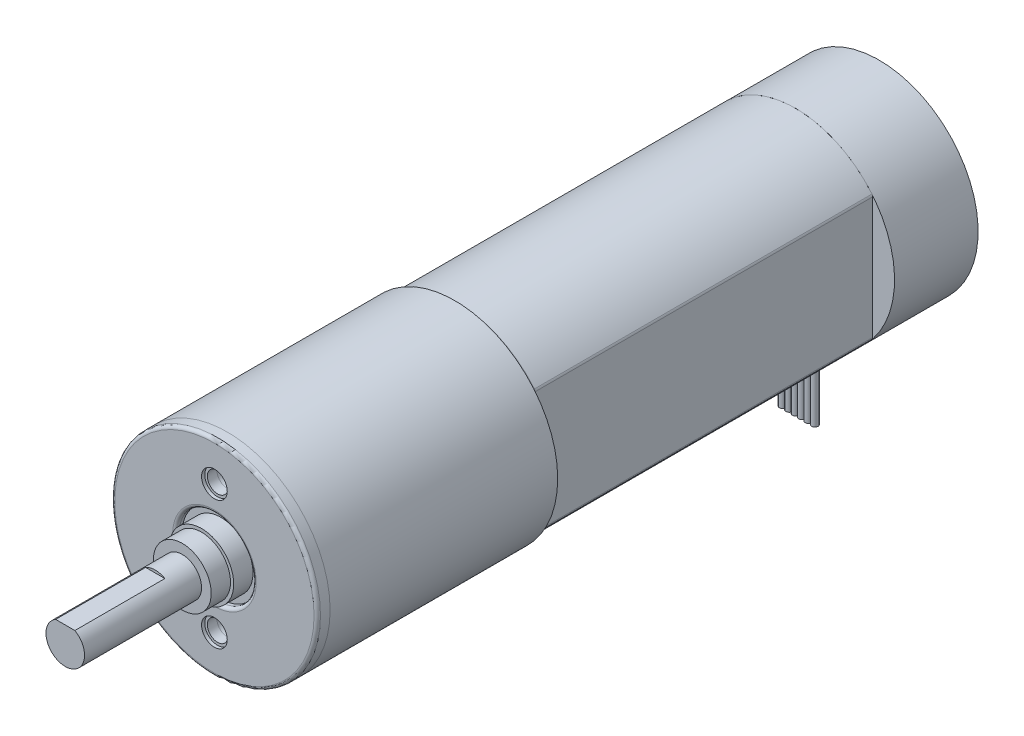
from build123d import *

# Parameters (mm, degrees)
SKETCH_1_R                       = 7.7
EXTRUDE_1_DEPTH                  = 26.5
CUT_EXTRUDE_1_DEPTH              = 29.65013089
FILLET_1_R                       = 0.25
SKETCH_4_R                       = 8
EXTRUDE_2_DEPTH                  = 17.7
SKETCH_5_R                       = 8
EXTRUDE_3_DEPTH                  = 1
SKETCH_6_R                       = 3
CUT_EXTRUDE_2_DEPTH              = 0.5
FILLET_3_R                       = 0.25
SKETCH_7_R                       = 2.5
EXTRUDE_4_DEPTH                  = 1.5
SKETCH_8_R                       = 2.25
EXTRUDE_5_DEPTH                  = 1.5
SKETCH_9_R                       = 1.5
EXTRUDE_6_DEPTH                  = 9.1
CUT_EXTRUDE_3_DEPTH              = 7
M2X0_4_1_AT_2_COUNT              = 2
M2X0_4_1_AT_2_PITCH              = 10
SKETCH_16_R                      = 1
CUT_EXTRUDE_4_DEPTH              = 0.25
CUT_EXTRUDE_5_DEPTH              = 0.75
SKETCH_18_R                      = 2.5
EXTRUDE_7_DEPTH                  = 2.5
FILLET_4_R                       = 0.25
SKETCH_19_R                      = 0.5
EXTRUDE_8_DEPTH                  = 0.5
SKETCH_20_W                      = 0.6
SKETCH_20_H                      = 0.2
EXTRUDE_9_DEPTH                  = 3
SKETCH_21_R                      = 0.15
CUT_EXTRUDE_6_DEPTH              = 60.02075906
FILLET_5_R                       = 0.3
PATTERN_CIRCULAR_1_COUNT         = 2
FILLET_5_OF_PATTERN_CIRCULAR_1_R = 0.3
SKETCH_23_R                      = 7.7
EXTRUDE_10_DEPTH                 = 6.5
CUT_EXTRUDE_7_DEPTH              = 60.068180968
CUT_EXTRUDE_7_DEPTH_BACK         = 3
SKETCH_25_W                      = 3
SKETCH_25_H                      = 0.5
SKETCH_26_R                      = 0.25
EXTRUDE_13_DEPTH                 = 10
PATTERN_LINEAR_1_COUNT           = 6
PATTERN_LINEAR_1_PITCH           = 0.5


with BuildPart() as part:
    # 草圖1 → 填料-伸長1 (new body)
    with BuildSketch(Plane.XY):
        Circle(SKETCH_1_R)
    extrude(amount=EXTRUDE_1_DEPTH)

    # 草圖2 → 除料-伸長1 (cut, through all)
    with BuildSketch(Plane.XY.offset(26.5)):
        with BuildLine():
            Line((-6, -4.825971405), (-6, 4.825971405))
            ThreePointArc((-6, 4.825971405), (-7.7, 0), (-6, -4.825971405))
        make_face()
        with BuildLine():
            ThreePointArc((7.7, 0), (7.262575301, 2.558319761), (6, 4.825971405))
            Line((6, 4.825971405), (6, -4.825971405))
            ThreePointArc((6, -4.825971405), (7.262575301, -2.558319761), (7.7, 0))
        make_face()
    extrude(amount=-CUT_EXTRUDE_1_DEPTH, mode=Mode.SUBTRACT)

    # 圓角1
    fillet_1_edges = [part.edges().sort_by_distance(p)[0] for p in [
        (-6, 0, 26.5),
        (-6, 4.825971405, 13.25),
        (-6, -4.825971405, 13.25),
        (6, 4.825971405, 13.25),
        (6, -4.825971405, 13.25),
        (6, 0, 26.5),
        (0, 7.7, 26.5),
        (0, -7.7, 26.5),
    ]]
    fillet(fillet_1_edges, radius=FILLET_1_R)

    # 草圖4 → 填料-伸長2 (add)
    with BuildSketch(Plane.XY.offset(26.5)):
        Circle(SKETCH_4_R)
    extrude(amount=EXTRUDE_2_DEPTH)


with BuildPart() as body_2:
    # 草圖5 → 填料-伸長3 (new body)
    with BuildSketch(Plane.XY.offset(44.2)):
        Circle(SKETCH_5_R)
    extrude(amount=EXTRUDE_3_DEPTH)

    # 草圖6 → 除料-伸長2 (cut)
    with BuildSketch(Plane.XY.offset(45.2)):
        Circle(SKETCH_6_R)
    extrude(amount=-CUT_EXTRUDE_2_DEPTH, mode=Mode.SUBTRACT)

    # 圓角3
    fillet_3_edges = [body_2.edges().sort_by_distance(p)[0] for p in [
        (-8, 0, 45.2),
        (-3, 0, 45.2),
    ]]
    fillet(fillet_3_edges, radius=FILLET_3_R)

    # 草圖7 → 填料-伸長4 (add)
    with BuildSketch(Plane.XY.offset(44.7)):
        Circle(SKETCH_7_R)
    extrude(amount=EXTRUDE_4_DEPTH)


with BuildPart() as body_3:
    # 草圖8 → 填料-伸長5 (new body)
    with BuildSketch(Plane.XY.offset(46.2)):
        Circle(SKETCH_8_R)
    extrude(amount=EXTRUDE_5_DEPTH)

    # 草圖9 → 填料-伸長6 (add)
    with BuildSketch(Plane.XY.offset(47.7)):
        Circle(SKETCH_9_R)
    extrude(amount=EXTRUDE_6_DEPTH)

    # 草圖10 → 除料-伸長3 (cut)
    with BuildSketch(Plane.XY.offset(56.8)):
        with BuildLine():
            Line((-0.748331477, 1.3), (0.748331477, 1.3))
            ThreePointArc((0.748331477, 1.3), (0, 1.5), (-0.748331477, 1.3))
        make_face()
    extrude(amount=-CUT_EXTRUDE_3_DEPTH, mode=Mode.SUBTRACT)


with BuildPart() as m2x0_4_1_tool:
    # 草圖15 → M2x0.4 螺紋孔1 (revolve)
    with BuildSketch(Plane(origin=(0, -5, 45.2), x_dir=(0, -1, 0), z_dir=(1, 0, 0))):
        Polygon((0, 0), (0, 3.480688495), (0.8, 3), (0.8, 0), align=None)
    m2x0_4_1 = revolve(axis=Axis((0, -5, 51.55), (0, 0, -1)))


with BuildPart() as part_1:
    add(part.part)

    # M2x0.4 螺紋孔1: cut by m2x0_4_1_tool
    add(m2x0_4_1_tool.part, mode=Mode.SUBTRACT)


with BuildPart() as body_2_1:
    add(body_2.part)

    # M2x0.4 螺紋孔1: cut by m2x0_4_1_tool
    add(m2x0_4_1_tool.part, mode=Mode.SUBTRACT)


with BuildPart() as m2x0_4_1_at_2_tool:
    # M2x0.4 螺紋孔1 at 2: M2x0.4 螺紋孔1 ×2
    with Locations(*[(0, i * M2X0_4_1_AT_2_PITCH, 0) for i in range(1, M2X0_4_1_AT_2_COUNT)]):
        add(m2x0_4_1)


with BuildPart() as part_2:
    add(part_1.part)

    # M2x0.4 螺紋孔1 at 2: cut by m2x0_4_1_at_2_tool
    add(m2x0_4_1_at_2_tool.part, mode=Mode.SUBTRACT)

    # 草圖17 → 除料-伸長5 (cut)
    with BuildSketch(Plane(origin=(0, 0, 0), x_dir=(-1, 0, 0), z_dir=(0, 0, -1))):
        with BuildLine():
            Line((-5.75, 4.631978395), (-5.75, -4.631978395))
            ThreePointArc((-5.75, -4.631978395), (0, -7.383611844), (5.75, -4.631978395))
            Line((5.75, -4.631978395), (5.75, 4.631978395))
            ThreePointArc((5.75, 4.631978395), (0, 7.383611844), (-5.75, 4.631978395))
        make_face()
    extrude(amount=-CUT_EXTRUDE_5_DEPTH, mode=Mode.SUBTRACT)

    # 草圖18 → 填料-伸長7 (add)
    with BuildSketch(Plane(origin=(0, 0, 0.75), x_dir=(-1, 0, 0), z_dir=(0, 0, -1))):
        with Locations(Location((0, 0, 0), (0, 0, 180))):
            Circle(SKETCH_18_R)
    extrude(amount=EXTRUDE_7_DEPTH)

    # 圓角4
    fillet_4_edges = [part_2.edges().sort_by_distance(p)[0] for p in [
        (-2.5, 0, -1.75),
    ]]
    fillet(fillet_4_edges, radius=FILLET_4_R)

    # 草圖19 → 填料-伸長8 (add)
    with BuildSketch(Plane(origin=(0, 0, 0.75), x_dir=(-1, 0, 0), z_dir=(0, 0, -1))):
        with Locations((0, 6)):
            Circle(SKETCH_19_R)
    extrude_8 = extrude(amount=EXTRUDE_8_DEPTH)

    # 草圖20 → 填料-伸長9 (add)
    with BuildSketch(Plane(origin=(0, 0, 0.25), x_dir=(-1, 0, 0), z_dir=(0, 0, -1))):
        with Locations((0, 6)):
            Rectangle(SKETCH_20_W, SKETCH_20_H)
    extrude_9 = extrude(amount=EXTRUDE_9_DEPTH)

    # 草圖21 → 除料-伸長6 (cut, through all)
    with BuildSketch(Plane.XZ.offset(-5.9)):
        with Locations(Location((0, -2.25, 0), (0, 0, 270))):
            Circle(SKETCH_21_R)
    cut_extrude_6 = extrude(amount=-CUT_EXTRUDE_6_DEPTH, mode=Mode.SUBTRACT)

    # 圓角5
    fillet_5_edges = [part_2.edges().sort_by_distance(p)[0] for p in [
        (-0.3, 6, -2.75),
        (0.3, 6, -2.75),
    ]]
    fillet(fillet_5_edges, radius=FILLET_5_R - 0.0001)  # a hair under: the kernel refuses the full size

    # 環狀複製排列1: 填料-伸長8, 填料-伸長9, 除料-伸長6 ×2 about axis
    pattern_circular_1_axis = Axis((0, 0, 0), (0, 0, 1))
    add([extrude_8.rotate(pattern_circular_1_axis, i * 360 / PATTERN_CIRCULAR_1_COUNT) for i in range(1, PATTERN_CIRCULAR_1_COUNT)])
    add([extrude_9.rotate(pattern_circular_1_axis, i * 360 / PATTERN_CIRCULAR_1_COUNT) for i in range(1, PATTERN_CIRCULAR_1_COUNT)])
    add([cut_extrude_6.rotate(pattern_circular_1_axis, i * 360 / PATTERN_CIRCULAR_1_COUNT) for i in range(1, PATTERN_CIRCULAR_1_COUNT)], mode=Mode.SUBTRACT)

    # 圓角5 of 環狀複製排列1
    fillet_5_of_pattern_circular_1_edges = [part_2.edges().sort_by_distance(p)[0] for p in [
        (0.3, -6, -2.75),
        (-0.3, -6, -2.75),
    ]]
    fillet(fillet_5_of_pattern_circular_1_edges, radius=FILLET_5_OF_PATTERN_CIRCULAR_1_R - 0.0001)  # a hair under: the kernel refuses the full size


with BuildPart() as body_2_2:
    add(body_2_1.part)

    # M2x0.4 螺紋孔1 at 2: cut by m2x0_4_1_at_2_tool
    add(m2x0_4_1_at_2_tool.part, mode=Mode.SUBTRACT)

    # 草圖16 → 除料-伸長4 (cut)
    with BuildSketch(Plane.XY.offset(45.2)):
        with Locations((0, -5)):
            Circle(SKETCH_16_R)
        with Locations((0, 5)):
            Circle(SKETCH_16_R)
    extrude(amount=-CUT_EXTRUDE_4_DEPTH, mode=Mode.SUBTRACT)


with BuildPart() as body_4:
    # 草圖23 → 填料-伸長10 (new body)
    with BuildSketch(Plane(origin=(0, 0, 0), x_dir=(-1, 0, 0), z_dir=(0, 0, -1))):
        with Locations(Location((0, 0, 0), (0, 0, 180))):
            Circle(SKETCH_23_R)
    extrude(amount=EXTRUDE_10_DEPTH)


with BuildPart() as cut_extrude_7_tool:
    # 草圖25 → 除料-伸長7 (new, two sides: drawn at the far end of the back side and taken through both)
    with BuildSketch(Plane.XZ.offset(6.1).offset(-CUT_EXTRUDE_7_DEPTH_BACK)):
        with Locations((0, -0.25)):
            Rectangle(SKETCH_25_W, SKETCH_25_H)
    extrude(amount=CUT_EXTRUDE_7_DEPTH + CUT_EXTRUDE_7_DEPTH_BACK)


with BuildPart() as part_3:
    add(part_2.part)

    # 除料-伸長7: cut by cut_extrude_7_tool
    add(cut_extrude_7_tool.part, mode=Mode.SUBTRACT)


with BuildPart() as body_4_1:
    add(body_4.part)

    # 除料-伸長7: cut by cut_extrude_7_tool
    add(cut_extrude_7_tool.part, mode=Mode.SUBTRACT)


with BuildPart() as body_5:
    # 草圖26 → 填料-伸長13 (new body)
    with BuildSketch(Plane.XZ.offset(3.1)):
        with Locations(Location((-1.25, -0.25, 0), (0, 0, 270))):
            Circle(SKETCH_26_R)
    extrude_13 = extrude(amount=EXTRUDE_13_DEPTH)


with BuildPart() as pattern_linear_1_1:
    # 直線複製排列1: 填料-伸長13 ×6
    with Locations(*[(i * PATTERN_LINEAR_1_PITCH, 0, 0) for i in range(1, PATTERN_LINEAR_1_COUNT)]):
        add(extrude_13)


solid = Compound([body_3.part, body_2_2.part, part_3.part, body_4_1.part, body_5.part, pattern_linear_1_1.part])
